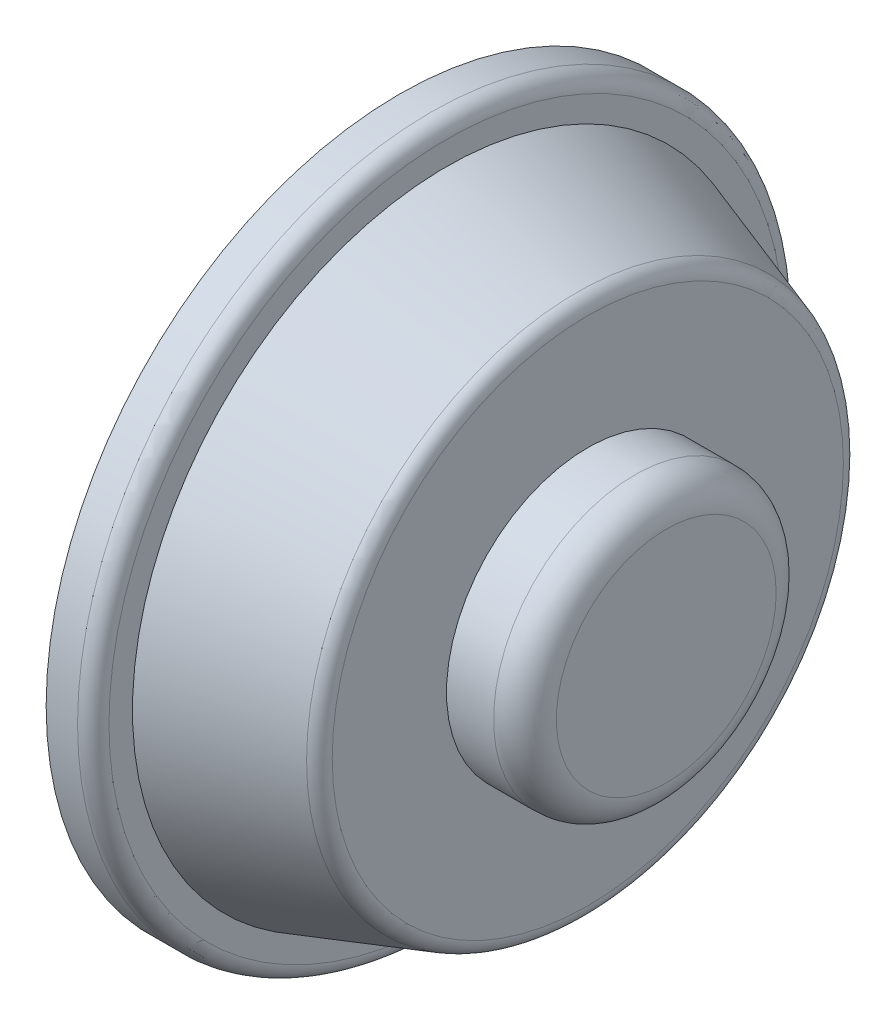
from build123d import *

# Parameters (mm, degrees)
SKETCH1_R           = 22.5
BOSS_EXTRUDE1_DEPTH = 3
SKETCH3_R           = 17
SKETCH2_R           = 20
SKETCH4_R           = 9
BOSS_EXTRUDE2_DEPTH = 5
FILLET1_R           = 2
FILLET2_R           = 1
SKETCH5_R           = 21
CUT_EXTRUDE1_DEPTH  = 2
BOSS_EXTRUDE3_START = 1
SKETCH6_R           = 21
SKETCH6_R_2         = 16
BOSS_EXTRUDE3_DEPTH = 1
FILLET3_R           = 6


with BuildPart() as part:
    # Sketch1 → Boss-Extrude1 (new body)
    with BuildSketch(Plane(origin=(0, 0, 0), x_dir=(0, 0, -1), z_dir=(1, 0, 0))):
        Circle(SKETCH1_R)
    extrude(amount=BOSS_EXTRUDE1_DEPTH)

    # Sketch3 → Loft1 section 0
    with BuildSketch(Plane(origin=(12, 0, 0), x_dir=(0, 0, -1), z_dir=(1, 0, 0))):
        Circle(SKETCH3_R)
    # Sketch2 → Loft1 section 1
    with BuildSketch(Plane(origin=(3, 0, 0), x_dir=(0, 0, -1), z_dir=(1, 0, 0))):
        Circle(SKETCH2_R)
    loft()

    # Sketch4 → Boss-Extrude2 (add)
    with BuildSketch(Plane(origin=(12, 0, 0), x_dir=(0, 0, -1), z_dir=(1, 0, 0))):
        Circle(SKETCH4_R)
    extrude(amount=BOSS_EXTRUDE2_DEPTH)

    # Fillet1
    fillet1_edges = [part.edges().sort_by_distance(p)[0] for p in [
        (17, 0, 9),
    ]]
    fillet(fillet1_edges, radius=FILLET1_R)

    # Fillet2
    fillet2_edges = [part.edges().sort_by_distance(p)[0] for p in [
        (3, 0, 22.5),
        (12, 0, 17),
    ]]
    fillet(fillet2_edges, radius=FILLET2_R)

    # Sketch5 → Cut-Extrude1 (cut)
    with BuildSketch(Plane.ZY):
        Circle(SKETCH5_R)
    extrude(amount=-CUT_EXTRUDE1_DEPTH, mode=Mode.SUBTRACT)

    # Sketch6 → Boss-Extrude3 (add)
    with BuildSketch(Plane.ZY.offset(-2).offset(BOSS_EXTRUDE3_START)):
        Circle(SKETCH6_R)
        Circle(SKETCH6_R_2, mode=Mode.SUBTRACT)
    extrude(amount=-BOSS_EXTRUDE3_DEPTH)

    # Fillet3
    # the kernel refuses this fillet: 6 mm, written as the material it takes off along each edge
    with BuildSketch(Plane(origin=(1, 0, 0), x_dir=(0, 0, 1), z_dir=(0, -1, 0))) as fillet3_piece_1:
        with BuildLine():
            CenterArc((19.31662479, -6), FILLET3_R, 90, 33.557309762)
            Line((16, -1), (16, 0))
            Line((16, 0), (19.31662479, 0))
        make_face()
    revolve(axis=Axis((1, 0, 0), (-1, 0, 0)), mode=Mode.SUBTRACT)


solid = part.part
